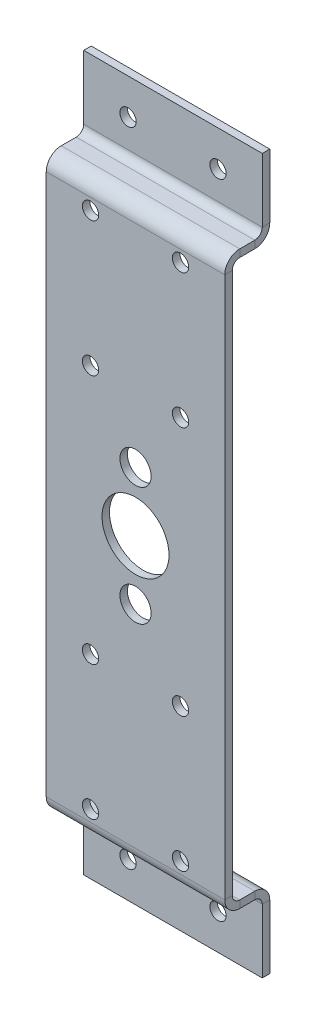
from build123d import *

# Parameters (mm, degrees)
SALIENTE_EXTRUIR1_DEPTH   = 31.75
CONVERTIR_S_LIDO1_START   = -31.75
CONVERTIR_S_LIDO1_DEPTH   = 63.5
CONVERTIR_S_LIDO1_2_DEPTH = 63.5
CROQUIS7_R                = 2.8956
CROQUIS7_R_2              = 5.5499
CROQUIS7_R_3              = 11.9126
CORTAR_EXTRUIR1_DEPTH     = 132.88300309


# Read off the part's stored shape, not the designer's step: Convertir-Sólido1
with BuildPart() as part:
    # Croquis2 → Saliente-Extruir1 (new, symmetric)
    with BuildSketch(Plane(origin=(0, 0, 0), x_dir=(0, 0, -1), z_dir=(1, 0, 0))):
        Polygon((0, 101.6), (0, -101.6), (13.335, -101.6), (13.335, -127), (16.002, -127), (16.002, -98.933), (2.667, -98.933), (2.667, 98.933), (16.002, 98.933), (16.002, 127), (13.335, 127), (13.335, 101.6), align=None)
    extrude(amount=SALIENTE_EXTRUIR1_DEPTH, both=True)

    # Convertir-Sólido1 outline → Convertir-Sólido1 (cut)
    with BuildSketch(Plane.YZ.offset(CONVERTIR_S_LIDO1_START)):
        with BuildLine():
            Line((101.6, 0), (96.266, 0))
            ThreePointArc((96.266, 0), (100.037707571, -1.562292429), (101.6, -5.334))
            Line((101.6, -5.334), (101.6, 0))
        make_face()
        with BuildLine():
            Line((-101.6, 0), (-101.6, -5.334))
            ThreePointArc((-101.6, -5.334), (-100.037707571, -1.562292429), (-96.266, 0))
            Line((-96.266, 0), (-101.6, 0))
        make_face()
        with BuildLine():
            ThreePointArc((104.267, -16.002), (100.495292429, -14.439707571), (98.933, -10.668))
            Line((98.933, -10.668), (98.933, -16.002))
            Line((98.933, -16.002), (104.267, -16.002))
        make_face()
        with BuildLine():
            ThreePointArc((-98.933, -10.668), (-100.495292429, -14.439707571), (-104.267, -16.002))
            Line((-104.267, -16.002), (-98.933, -16.002))
            Line((-98.933, -16.002), (-98.933, -10.668))
        make_face()
    extrude(amount=CONVERTIR_S_LIDO1_DEPTH, mode=Mode.SUBTRACT)

    # Convertir-S_lido1 2 outline → Convertir-S_lido1 2 (add)
    with BuildSketch(Plane.YZ.offset(CONVERTIR_S_LIDO1_START)):
        with BuildLine():
            ThreePointArc((104.267, -13.335), (102.381146215, -12.553853785), (101.6, -10.668))
            Line((101.6, -10.668), (101.6, -13.335))
            Line((101.6, -13.335), (104.267, -13.335))
        make_face()
        with BuildLine():
            ThreePointArc((-101.6, -10.668), (-102.381146215, -12.553853785), (-104.267, -13.335))
            Line((-104.267, -13.335), (-101.6, -13.335))
            Line((-101.6, -13.335), (-101.6, -10.668))
        make_face()
        with BuildLine():
            Line((98.933, -2.667), (96.266, -2.667))
            ThreePointArc((96.266, -2.667), (98.151853785, -3.448146215), (98.933, -5.334))
            Line((98.933, -5.334), (98.933, -2.667))
        make_face()
        with BuildLine():
            Line((-98.933, -2.667), (-98.933, -5.334))
            ThreePointArc((-98.933, -5.334), (-98.151853785, -3.448146215), (-96.266, -2.667))
            Line((-96.266, -2.667), (-98.933, -2.667))
        make_face()
    extrude(amount=CONVERTIR_S_LIDO1_2_DEPTH)

    # Croquis7 → Cortar-Extruir1 (cut, through all)
    with BuildSketch(Plane.XY):
        with Locations((-16.002, -114.3)):
            Circle(CROQUIS7_R)
        with Locations((16.002, -114.3)):
            Circle(CROQUIS7_R)
        with Locations((-16.002, -92.202)):
            Circle(CROQUIS7_R)
        with Locations((16.002, -92.202)):
            Circle(CROQUIS7_R)
        with Locations((-16.002, -44.45)):
            Circle(CROQUIS7_R)
        with Locations((16.002, -44.45)):
            Circle(CROQUIS7_R)
        with Locations((0, -21.082)):
            Circle(CROQUIS7_R_2)
        Circle(CROQUIS7_R_3)
        with Locations(Location((0, 21.082, 0), (0, 0, 180))):
            Circle(CROQUIS7_R_2)
        with Locations(Location((16.002, 44.45, 0), (0, 0, 180))):
            Circle(CROQUIS7_R)
        with Locations(Location((-16.002, 44.45, 0), (0, 0, 180))):
            Circle(CROQUIS7_R)
        with Locations(Location((16.002, 92.202, 0), (0, 0, 180))):
            Circle(CROQUIS7_R)
        with Locations(Location((-16.002, 92.202, 0), (0, 0, 180))):
            Circle(CROQUIS7_R)
        with Locations(Location((16.002, 114.3, 0), (0, 0, 180))):
            Circle(CROQUIS7_R)
        with Locations(Location((-16.002, 114.3, 0), (0, 0, 180))):
            Circle(CROQUIS7_R)
    extrude(amount=-CORTAR_EXTRUIR1_DEPTH, mode=Mode.SUBTRACT)


solid = part.part
